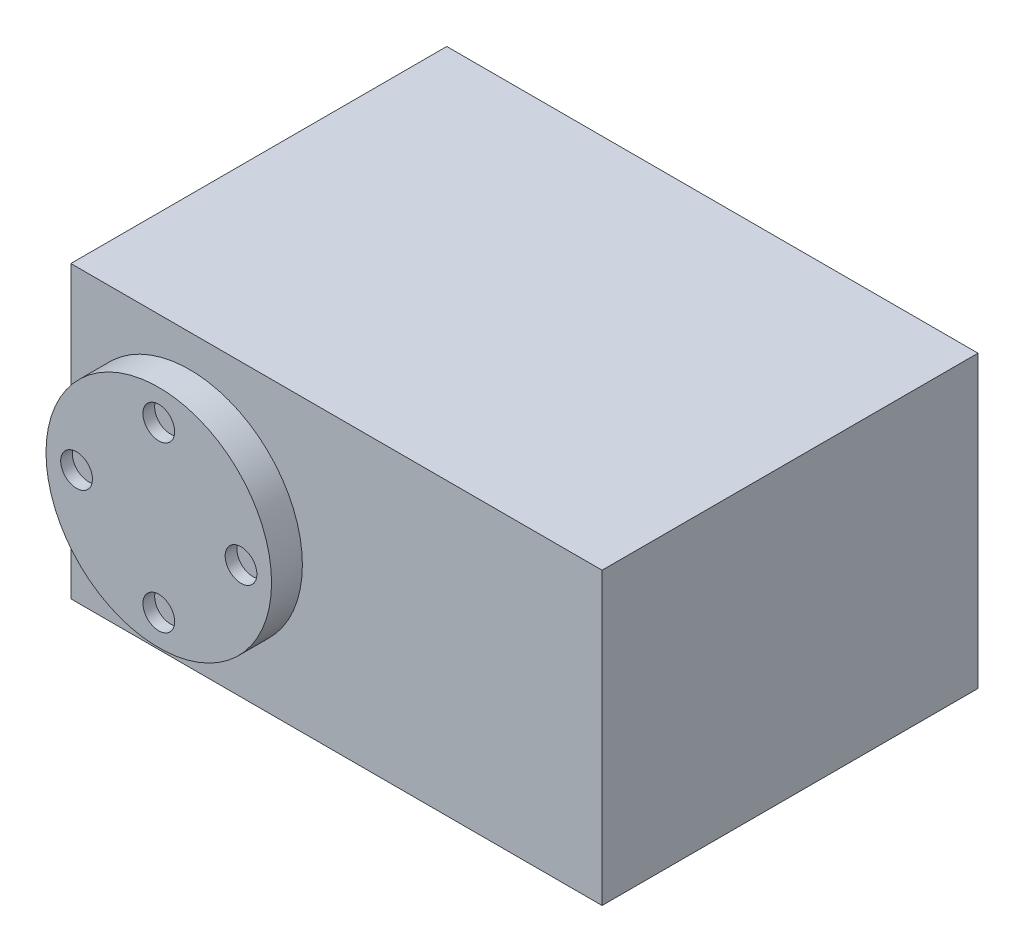
from build123d import *

# Parameters (mm, degrees)
S_BOX1_W     = 45.22
S_BOX1_H     = 24.72
BOSS_1_DEPTH = 32
S_CYL2_R     = 9.6
BOSS_2_DEPTH = 3.125
S_CYL3_R     = 9.6
BOSS_3_DEPTH = 3.125
S_HOLE4_R    = 1.35
HOLE_4_DEPTH = 1.1
S_HOLE5_R    = 1.35
HOLE_5_DEPTH = 1.1
S_HOLE6_R    = 1.35
HOLE_6_DEPTH = 1.1
S_HOLE7_R    = 1.35
HOLE_7_DEPTH = 1.1


with BuildPart() as part:
    # S_box1 → Boss_1 (new body)
    with BuildSketch(Plane.XY.offset(-16)):
        with Locations((12.5, 0)):
            Rectangle(S_BOX1_W, S_BOX1_H)
    extrude(amount=BOSS_1_DEPTH)

    # S_cyl2 → Boss_2 (add)
    with BuildSketch(Plane.XY.offset(15.5)):
        Circle(S_CYL2_R)
    extrude(amount=BOSS_2_DEPTH)

    # S_cyl3 → Boss_3 (add)
    with BuildSketch(Plane.XY.offset(-18.625)):
        Circle(S_CYL3_R)
    extrude(amount=BOSS_3_DEPTH)

    # S_hole4 → Hole_4 (cut)
    with BuildSketch(Plane.XY.offset(17.625)):
        with Locations((7, 0)):
            Circle(S_HOLE4_R)
    extrude(amount=HOLE_4_DEPTH, mode=Mode.SUBTRACT)

    # S_hole5 → Hole_5 (cut)
    with BuildSketch(Plane.XY.offset(17.625)):
        with Locations((0, 7)):
            Circle(S_HOLE5_R)
    extrude(amount=HOLE_5_DEPTH, mode=Mode.SUBTRACT)

    # S_hole6 → Hole_6 (cut)
    with BuildSketch(Plane.XY.offset(17.625)):
        with Locations((-7, 0)):
            Circle(S_HOLE6_R)
    extrude(amount=HOLE_6_DEPTH, mode=Mode.SUBTRACT)

    # S_hole7 → Hole_7 (cut)
    with BuildSketch(Plane.XY.offset(17.625)):
        with Locations((0, -7)):
            Circle(S_HOLE7_R)
    extrude(amount=HOLE_7_DEPTH, mode=Mode.SUBTRACT)


solid = part.part
